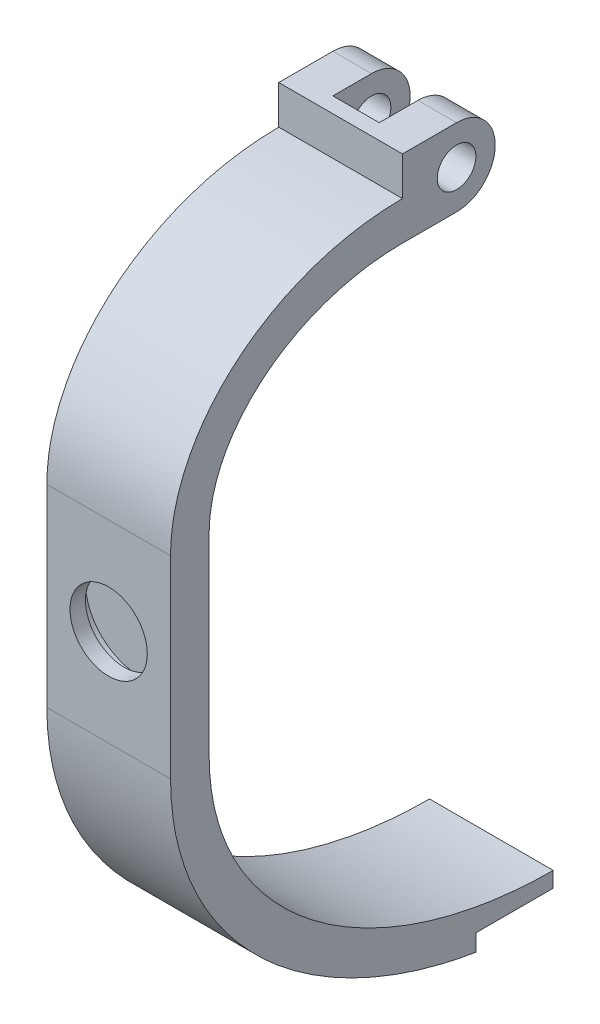
from build123d import *

# Parameters (mm, degrees)
BOSS_EXTRUDE2_DEPTH     = 10
CUT_EXTRUDE1_DEPTH      = 20.104973175
CUT_EXTRUDE1_DEPTH_BACK = 20.104973175
SKETCH3_R               = 2.5
SWEEP2_DEPTH            = 16
SKETCH6_W               = 16
SKETCH6_H               = 5
BOSS_EXTRUDE3_DEPTH     = 25
SWEEP4_DEPTH            = 16
SKETCH10_R              = 5
CUT_EXTRUDE2_DEPTH      = 2
SKETCH11_R              = 7
CUT_EXTRUDE3_DEPTH      = 2
CUT_EXTRUDE4_DEPTH      = 3
FILLET1_R               = 5


# Read off the part's stored shape, not the designer's step: Sweep2, Sweep4
with BuildPart() as part:
    # Sketch1 → Boss-Extrude2 (new body)
    with BuildSketch(Plane(origin=(0, 0, 0), x_dir=(1, 0, 0), z_dir=(0, 1, 0))):
        Polygon((16, 0), (11, 0), (11, -10), (5, -10), (5, 0), (0, 0), (0, -12), (16, -12), align=None)
    extrude(amount=BOSS_EXTRUDE2_DEPTH)

    # Sketch3 → Cut-Extrude1 (cut, two sides: drawn at the far end of the back side and taken through both)
    with BuildSketch(Plane(origin=(5, 0, 0), x_dir=(0, 0, -1), z_dir=(1, 0, 0)).offset(-CUT_EXTRUDE1_DEPTH_BACK)):
        with Locations((-5, 5)):
            Circle(SKETCH3_R)
    extrude(amount=CUT_EXTRUDE1_DEPTH + CUT_EXTRUDE1_DEPTH_BACK, mode=Mode.SUBTRACT)

    # Sweep2 outline → Sweep2 (add)
    with BuildSketch(Plane.YZ):
        with BuildLine():
            Line((0, 12), (5, 12))
            add(Edge.make_bspline(
                [(5, 12), (4.988564835, 13.918737728), (4.727583023, 17.475192083), (3.864503942, 21.128495988), (3.223332084, 23.150620925), (2.391953002, 25.596644311), (0.741742694, 29.07437946), (-1.195562511, 31.850987055), (-2.528545692, 33.517302555), (-4.236222293, 35.44635739), (-7.052881596, 37.829760239), (-9.410175401, 39.223738473), (-10.800753457, 39.913031483), (-12.581881784, 40.734670966), (-15.819763626, 41.734575995), (-18.630582656, 41.980830062), (-20, 42)],
                knots=[0, 0, 0, 0, 0.14, 0.25, 0.25, 0.28, 0.42, 0.5, 0.5, 0.56, 0.67, 0.75, 0.75, 0.78, 0.89, 1, 1, 1, 1], degree=3))
            Line((-20, 42), (-20, 37))
            add(Edge.make_bspline(
                [(0, 12), (0, 13.649915823), (-0.240561875, 16.726331061), (-0.97538393, 19.848301285), (-1.521193083, 21.57165859), (-2.228979288, 23.654488426), (-3.634756743, 26.603340395), (-5.233025509, 28.896620946), (-6.326493526, 30.263455967), (-7.72168743, 31.836224776), (-10.002621636, 33.761203681), (-11.850285326, 34.854843846), (-12.93353849, 35.390906407), (-14.317667102, 36.027380757), (-16.81674582, 36.792085808), (-18.962910054, 37), (-20, 37)],
                knots=[0, 0, 0, 0, 0.14, 0.25, 0.25, 0.28, 0.42, 0.5, 0.5, 0.56, 0.67, 0.75, 0.75, 0.78, 0.89, 1, 1, 1, 1], degree=3))
        make_face()
    extrude(amount=SWEEP2_DEPTH)

    # Sketch6 → Boss-Extrude3 (add)
    with BuildSketch(Plane.XZ.offset(20)):
        with Locations((8, 39.5)):
            Rectangle(SKETCH6_W, SKETCH6_H)
    extrude(amount=BOSS_EXTRUDE3_DEPTH)

    # Sweep4 outline → Sweep4 (add)
    with BuildSketch(Plane.YZ):
        with BuildLine():
            add(Edge.make_bspline(
                [(-45, 37), (-46.539921435, 37), (-49.710455321, 36.733564359), (-54.069426949, 35.591421338), (-56.791855208, 34.424962301), (-58.400322026, 33.61534539), (-60.515823703, 32.472825795), (-64.131778614, 29.955184919), (-67.512968495, 26.682711344), (-69.293125668, 24.545529462), (-70.568838354, 22.923551904), (-73.245629189, 19.149689178), (-75.823464115, 13.964627374), (-77.246943912, 9.829702386), (-78.247594027, 6.616051335), (-79.558969896, 1.063749954), (-80, -4.423299828), (-80, -7.5)],
                knots=[0, 0, 0, 0, 0.093333333, 0.186666667, 0.25, 0.25, 0.28, 0.373333333, 0.466666667, 0.5, 0.5, 0.56, 0.706666667, 0.75, 0.75, 0.853333333, 1, 1, 1, 1], degree=3))
            Line((-45, 37), (-45, 42))
            add(Edge.make_bspline(
                [(-45, 42), (-46.827228691, 41.985546272), (-50.572377089, 41.690203176), (-55.680170711, 40.34427149), (-58.86435237, 38.978190659), (-60.736493627, 38.036368786), (-63.19327858, 36.710836458), (-67.336625432, 33.820292899), (-71.161008214, 30.117283698), (-73.164977368, 27.709927549), (-74.598724896, 25.886689015), (-77.598031299, 21.658467407), (-80.427894177, 15.95136859), (-81.990291212, 11.413560853), (-83.08845552, 7.889758882), (-84.526539356, 1.812231065), (-84.988008876, -4.14655051), (-85, -7.5)],
                knots=[0, 0, 0, 0, 0.093333333, 0.186666667, 0.25, 0.25, 0.28, 0.373333333, 0.466666667, 0.5, 0.5, 0.56, 0.706666667, 0.75, 0.75, 0.853333333, 1, 1, 1, 1], degree=3))
            Line((-85, -7.5), (-80, -7.5))
        make_face()
    extrude(amount=SWEEP4_DEPTH)

    # Sketch10 → Cut-Extrude2 (cut)
    with BuildSketch(Plane.XY.offset(42)):
        with Locations((8, -32.5)):
            Circle(SKETCH10_R)
    extrude(amount=-CUT_EXTRUDE2_DEPTH, mode=Mode.SUBTRACT)

    # Sketch11 → Cut-Extrude3 (cut)
    with BuildSketch(Plane.XY.offset(40)):
        with Locations((8, -32.5)):
            Circle(SKETCH11_R)
    extrude(amount=-CUT_EXTRUDE3_DEPTH, mode=Mode.SUBTRACT)

    # 3DSketch1 → Cut-Extrude4 (cut)
    with BuildSketch(Plane(origin=(0, -85, -7.5), x_dir=(0.8479983040050887, 0, 0.5299989400031789), z_dir=(0, 1, 0))):
        Polygon((0, 0), (13.567972864, 8.47998304), (18.867962264, 0), (5.2999894, -8.47998304), align=None)
    extrude(amount=CUT_EXTRUDE4_DEPTH, mode=Mode.SUBTRACT)

    # Fillet1
    fillet1_edges = [part.edges().sort_by_distance(p)[0] for p in [
        (13.5, 0, 0),
        (13.5, 10, 0),
        (2.5, 0, 0),
        (2.5, 10, 0),
    ]]
    fillet(fillet1_edges, radius=FILLET1_R - 0.0001)  # a hair under: the kernel refuses the full size


solid = part.part
